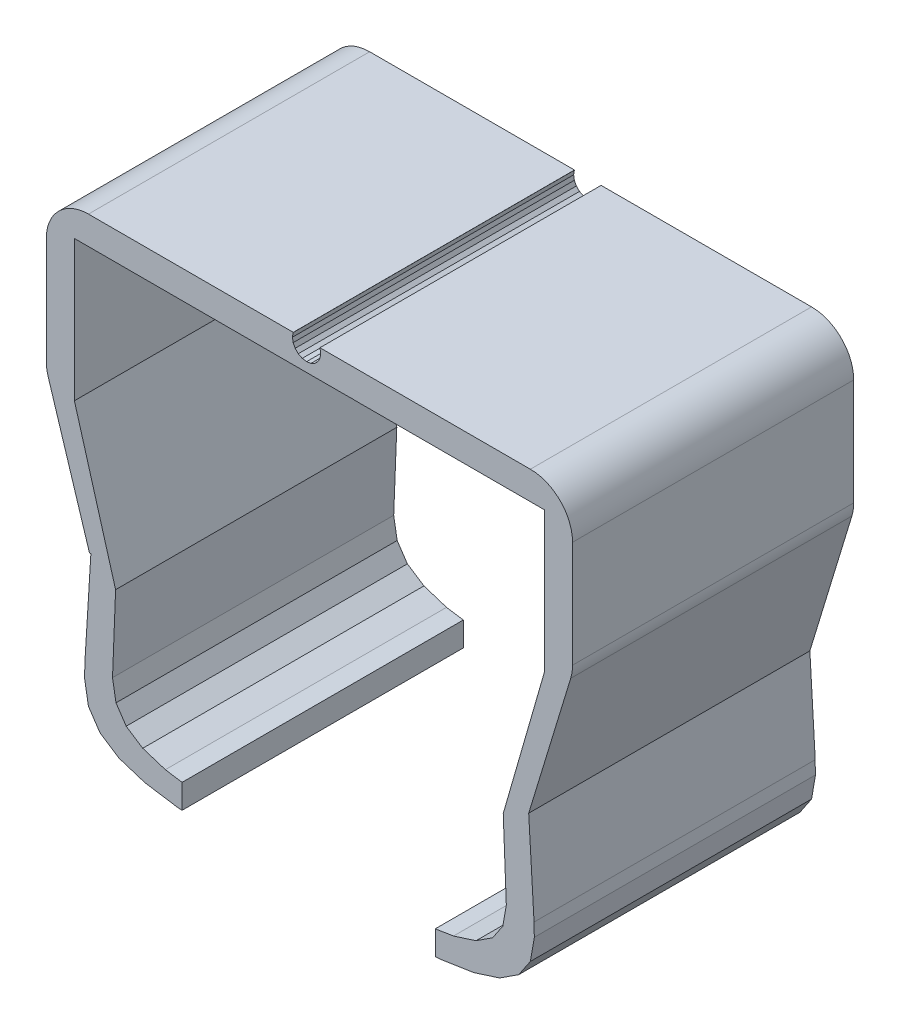
from build123d import *

# Parameters (mm, degrees)
BOSS_EXTRUDE1_DEPTH = 10


# Read off the part's stored shape, not the designer's step: Imported1
with BuildPart() as part:
    # Sketch5 → Boss-Extrude1 (new body)
    with BuildSketch(Plane.XY):
        with BuildLine():
            Line((-6.05700016, 98.805000305), (-6.127999783, 98.944999695))
            Line((-6.127999783, 98.944999695), (-6.152999878, 99.099998474))
            Line((-6.152999878, 99.099998474), (-6.127999783, 99.255996704))
            Line((-6.127999783, 99.255996704), (-6.123951545, 99.263979588))
            Line((-6.123951545, 99.263979588), (-13.408000231, 99.263979588))
            ThreePointArc((-13.408000231, 99.263979588), (-14.468660403, 98.82463976), (-14.908000231, 97.763979588))
            Line((-14.908000231, 97.763979588), (-14.908000231, 93.983181661))
            ThreePointArc((-14.908000231, 93.983181661), (-14.890789829, 93.756609361), (-14.839553555, 93.535236262))
            Line((-14.839553555, 93.535236262), (-13.37100029, 88.842002869))
            Line((-13.37100029, 88.842002869), (-13.322039604, 88.843772888))
            Line((-13.322039604, 88.843772888), (-13.524080276, 85.57485199))
            Line((-13.524080276, 85.57485199), (-13.550000191, 84.919998169))
            Line((-13.550000191, 84.919998169), (-13.409000397, 84.103996277))
            Line((-13.409000397, 84.103996277), (-12.994999886, 83.488998413))
            Line((-12.994999886, 83.488998413), (-12.32199955, 83.050003052))
            Line((-12.32199955, 83.050003052), (-11.402999878, 82.754997253))
            Line((-11.402999878, 82.754997253), (-10.253000259, 82.577003479))
            Line((-10.253000259, 82.577003479), (-10.078000069, 82.565231323))
            Line((-10.078000069, 82.565231323), (-10.078000069, 83.426826477))
            Line((-10.078000069, 83.426826477), (-10.673000336, 83.518997192))
            Line((-10.673000336, 83.518997192), (-11.477000237, 83.777000427))
            Line((-11.477000237, 83.777000427), (-12.065999985, 84.162002563))
            Line((-12.065999985, 84.162002563), (-12.428999901, 84.699996948))
            Line((-12.428999901, 84.699996948), (-12.552000046, 85.414001465))
            Line((-12.552000046, 85.414001465), (-12.44299984, 88.178001404))
            Line((-12.44299984, 88.178001404), (-13.908000231, 93.263979588))
            Line((-13.908000231, 93.263979588), (-13.908000231, 98.263979588))
            Line((-13.908000231, 98.263979588), (-4.410530424, 98.263979588))
            Line((-4.410530424, 98.263979588), (-3.957890034, 98.267951965))
            Line((-3.957890034, 98.267951965), (-3.944104194, 98.263979588))
            Line((-3.944104194, 98.263979588), (2.807999849, 98.263979588))
            Line((2.807999849, 98.263979588), (2.807999849, 93.263979588))
            Line((2.807999849, 93.263979588), (1.343000054, 88.178001404))
            Line((1.343000054, 88.178001404), (1.452999949, 85.414001465))
            Line((1.452999949, 85.414001465), (1.328999996, 84.699996948))
            Line((1.328999996, 84.699996948), (0.966000021, 84.162002563))
            Line((0.966000021, 84.162002563), (0.377000004, 83.777000427))
            Line((0.377000004, 83.777000427), (-0.426999986, 83.518997192))
            Line((-0.426999986, 83.518997192), (-1.072999954, 83.418922424))
            Line((-1.072999954, 83.418922424), (-1.072999954, 82.56186676))
            Line((-1.072999954, 82.56186676), (-0.84799999, 82.577003479))
            Line((-0.84799999, 82.577003479), (0.301999986, 82.754997253))
            Line((0.301999986, 82.754997253), (1.220999956, 83.050003052))
            Line((1.220999956, 83.050003052), (1.894000053, 83.488998413))
            Line((1.894000053, 83.488998413), (2.308000088, 84.103996277))
            Line((2.308000088, 84.103996277), (2.450000048, 84.919998169))
            Line((2.450000048, 84.919998169), (2.431600094, 85.381187439))
            Line((2.431600094, 85.381187439), (2.438999891, 85.382003784))
            Line((2.438999891, 85.382003784), (2.248559952, 88.639091492))
            Line((2.248559952, 88.639091492), (3.742796809, 93.540116743))
            ThreePointArc((3.742796809, 93.540116743), (3.791609542, 93.756422636), (3.807999849, 93.977561235))
            Line((3.807999849, 93.977561235), (3.807999849, 97.763979588))
            ThreePointArc((3.807999849, 97.763979588), (3.368660021, 98.82463976), (2.307999849, 99.263979588))
            Line((2.307999849, 99.263979588), (-5.176048197, 99.263979588))
            Line((-5.176048197, 99.263979588), (-5.171999931, 99.255996704))
            Line((-5.171999931, 99.255996704), (-5.147999763, 99.099998474))
            Line((-5.147999763, 99.099998474), (-5.171999931, 98.944999695))
            Line((-5.171999931, 98.944999695), (-5.243000031, 98.805000305))
            Line((-5.243000031, 98.805000305), (-5.355000019, 98.694000244))
            Line((-5.355000019, 98.694000244), (-5.494999886, 98.622001648))
            Line((-5.494999886, 98.622001648), (-5.650000095, 98.597999573))
            Line((-5.650000095, 98.597999573), (-5.804999828, 98.622001648))
            Line((-5.804999828, 98.622001648), (-5.945000172, 98.694000244))
            Line((-5.945000172, 98.694000244), (-6.05700016, 98.805000305))
        make_face()
    extrude(amount=-BOSS_EXTRUDE1_DEPTH)


solid = part.part
